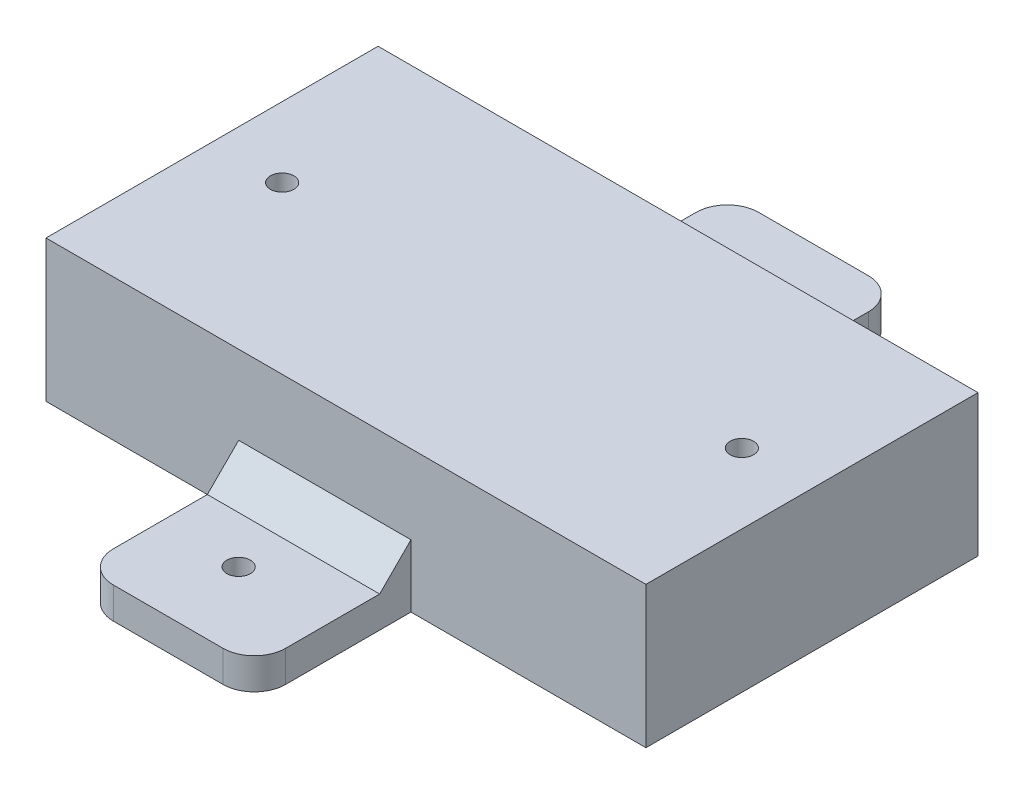
from build123d import *

# Parameters (mm, degrees)
SKETCH_1_W          = 76.6
SKETCH_1_H          = 42.4
EXTRUDE_1_DEPTH     = 18.07
SKETCH_2_R          = 1.5
CUT_EXTRUDE_1_DEPTH = 10
SKETCH_4_R          = 1.5
EXTRUDE_2_DEPTH     = 4
CHAMFER_1_SIZE      = 4


with BuildPart() as part:
    # Эскиз1 → Бобышка-Вытянуть1 (new body)
    with BuildSketch(Plane(origin=(0, 0, 0), x_dir=(1, 0, 0), z_dir=(0, 1, 0))):
        Rectangle(SKETCH_1_W, SKETCH_1_H)
    extrude(amount=EXTRUDE_1_DEPTH)

    # Эскиз2 → Вырез-Вытянуть1 (cut)
    with BuildSketch(Plane(origin=(0, 18.07, 0), x_dir=(1, 0, 0), z_dir=(0, 1, 0))):
        with Locations((29.35, 0)):
            Circle(SKETCH_2_R)
        with Locations((-29.35, 0)):
            Circle(SKETCH_2_R)
    extrude(amount=-CUT_EXTRUDE_1_DEPTH, mode=Mode.SUBTRACT)

    # Эскиз4 → Бобышка-Вытянуть2 (add)
    # profile 1 of 2: a face of its own
    with BuildSketch(Plane.XZ):
        with BuildLine():
            Line((8.3, 21.2), (-13.7, 21.2))
            Line((-13.7, 21.2), (-13.7, 37.2))
            ThreePointArc((-13.7, 37.2), (-12.528427125, 40.028427125), (-9.7, 41.2))
            Line((-9.7, 41.2), (4.3, 41.2))
            ThreePointArc((4.3, 41.2), (7.128427125, 40.028427125), (8.3, 37.2))
            Line((8.3, 37.2), (8.3, 21.2))
        make_face()
        with Locations((-3.7, 31.2)):
            Circle(SKETCH_4_R, mode=Mode.SUBTRACT)
    # profile 2 of 2: a face of its own
    with BuildSketch(Plane.XZ):
        with BuildLine():
            Line((4.3, -41.2), (-9.7, -41.2))
            ThreePointArc((-9.7, -41.2), (-12.528427125, -40.028427125), (-13.7, -37.2))
            Line((-13.7, -37.2), (-13.7, -21.2))
            Line((-13.7, -21.2), (8.3, -21.2))
            Line((8.3, -21.2), (8.3, -37.2))
            ThreePointArc((8.3, -37.2), (7.128427125, -40.028427125), (4.3, -41.2))
        make_face()
        with Locations((-3.7, -31.2)):
            Circle(SKETCH_4_R, mode=Mode.SUBTRACT)
    extrude(amount=-EXTRUDE_2_DEPTH)

    # Фаска1
    chamfer_1_edges = [part.edges().sort_by_distance(p)[0] for p in [
        (-2.7, 4, -21.2),
        (-2.7, 4, 21.2),
    ]]
    chamfer(chamfer_1_edges, length=CHAMFER_1_SIZE)


solid = part.part
